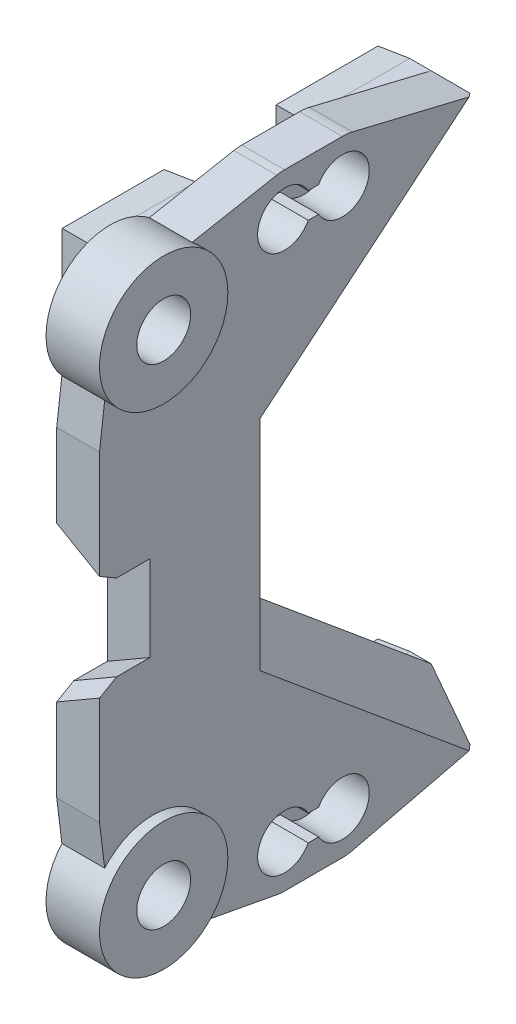
from build123d import *
from OCP.BRepFilletAPI import BRepFilletAPI_MakeChamfer

# Parameters (mm, degrees)
DOWELSUPPORT_DEPTH       = 1.905
DOWELSUPPORT_DEPTH_BACK  = 1.27
SKETCH3_R                = 3.81
SKETCH5_W                = 9.525
SKETCH5_H                = 19.05
SLIDERDOWELSUPPORT_DEPTH = 1.27
STRINGDOWELSUPPORT_DEPTH = 1.27
SKETCH9_W                = 6.35
SKETCH9_H                = 3
TABSUPPORT_DEPTH         = 1.27
INTERSUPPORT_DEPTH       = 1.27
DOWELHOLES_DEPTH         = 25.48367648
DOWELHOLES_DEPTH_BACK    = 25.48367648
SKETCH11_R               = 1.600000102
BOSS_EXTRUDE1_START      = -1.27
SKETCH11_2_R             = 1.600000102
BOSS_EXTRUDE1_DEPTH      = 0.254
SKETCH14_W               = 6.35
SKETCH14_H               = 3
TABBASE_DEPTH            = 1.27
SKETCH15_W               = 6.35
SKETCH15_H               = 3
TABDRAFT_DEPTH           = 1.73
TABDRAFT_DRAFT           = 5
TABDRAFT_PROFILE_2_DEPTH = 1.73
TABDRAFT_PROFILE_2_DRAFT = 5
CHAMFER1_SIZE            = 2.54
CUT_EXTRUDE2_DEPTH       = 3
CHAMFER2_SIZE            = 0.508
CHAMFER2_SIZE2           = 1.016


with BuildPart() as part:
    # Sketch3 → DowelSupport (new, two sides: drawn at the far end of the back side and taken through both)
    with BuildSketch(Plane(origin=(0, 0, 0), x_dir=(0, 0, -1), z_dir=(1, 0, 0)).offset(-DOWELSUPPORT_DEPTH_BACK)):
        with Locations((-3.175, 14.53375)):
            Circle(SKETCH3_R)
    extrude(amount=DOWELSUPPORT_DEPTH + DOWELSUPPORT_DEPTH_BACK)



with BuildPart() as body_2:
    # Sketch5 → SliderDowelSupport (new, symmetric)
    with BuildSketch(Plane(origin=(0, 0, 0), x_dir=(0, 0, -1), z_dir=(1, 0, 0))):
        with Locations((-1.5875, 0)):
            Rectangle(SKETCH5_W, SKETCH5_H)
    extrude(amount=SLIDERDOWELSUPPORT_DEPTH, both=True)


with BuildPart() as body_3:
    # Sketch8 → StringDowelSupport (new, symmetric)
    with BuildSketch(Plane(origin=(0, 0, 0), x_dir=(0, 0, -1), z_dir=(1, 0, 0))):
        with BuildLine():
            Line((4.6355, 18.542), (8.0645, 18.542))
            ThreePointArc((8.0645, 18.542), (10.6045, 16.002), (8.0645, 13.462))
            Line((8.0645, 13.462), (4.6355, 13.462))
            ThreePointArc((4.6355, 13.462), (2.0955, 16.002), (4.6355, 18.542))
        make_face()
    extrude(amount=STRINGDOWELSUPPORT_DEPTH, both=True)


with BuildPart() as part_1:
    add(part.part)

    add(body_3.part)  # TabSupport merges body 3
    # Sketch9 → TabSupport (add, symmetric)
    with BuildSketch(Plane(origin=(0, 0, 0), x_dir=(0, 0, -1), z_dir=(1, 0, 0))):
        with Locations((0, 15.24)):
            Rectangle(SKETCH9_W, SKETCH9_H)
        with Locations((12.7, 15.24)):
            Rectangle(SKETCH9_W, SKETCH9_H)
    extrude(amount=TABSUPPORT_DEPTH, both=True)


    add(body_2.part)  # InterSupport merges body 2
    # Sketch10 → InterSupport (add, symmetric)
    with BuildSketch(Plane(origin=(0, 0, 0), x_dir=(0, 0, -1), z_dir=(1, 0, 0))):
        Polygon((-6.35, 9.525), (-5.696013987, 14.843731414), (-3.644260291, 17.030026182), (4.166239709, 18.498276182), (8.657140431, 18.471894192), (15.875, 16.74), (15.875, 13.74), (3.175, 3.175), (3.175, 9.525), align=None)
    extrude(amount=INTERSUPPORT_DEPTH, both=True)

    # Sketch11 → DowelHoles (cut, two sides: drawn at the far end of the back side and taken through both)
    with BuildSketch(Plane(origin=(0, 0, 0), x_dir=(0, 0, -1), z_dir=(1, 0, 0)).offset(-DOWELHOLES_DEPTH_BACK)):
        with Locations((-3.175, 14.53375)):
            Circle(SKETCH11_R)
        with BuildLine():
            Line((6.04239599, 15.24), (6.65760401, 15.24))
            ThreePointArc((6.65760401, 15.24), (9.664500102, 16.002), (6.65760401, 16.764))
            Line((6.65760401, 16.764), (6.04239599, 16.764))
            ThreePointArc((6.04239599, 16.764), (3.035499898, 16.002), (6.04239599, 15.24))
        make_face()
    extrude(amount=DOWELHOLES_DEPTH + DOWELHOLES_DEPTH_BACK, mode=Mode.SUBTRACT)

    # Sketch11<2> → Boss-Extrude1 (add)
    with BuildSketch(Plane(origin=(0, 0, 0), x_dir=(0, 0, -1), z_dir=(1, 0, 0)).offset(BOSS_EXTRUDE1_START)):
        with BuildLine():
            Line((6.04239599, 15.24), (6.65760401, 15.24))
            ThreePointArc((6.65760401, 15.24), (9.664500102, 16.002), (6.65760401, 16.764))
            Line((6.65760401, 16.764), (6.04239599, 16.764))
            ThreePointArc((6.04239599, 16.764), (3.035499898, 16.002), (6.04239599, 15.24))
        make_face()
        with Locations((-3.175, 14.53375)):
            Circle(SKETCH11_2_R)
    extrude(amount=BOSS_EXTRUDE1_DEPTH)

    # Sketch14 → TabBase (add)
    with BuildSketch(Plane.ZY.offset(1.27)):
        with Locations((-12.7, 15.24)):
            Rectangle(SKETCH14_W, SKETCH14_H)
        with Locations((0, 15.24)):
            Rectangle(SKETCH14_W, SKETCH14_H)
    extrude(amount=TABBASE_DEPTH)


with BuildPart() as tabdraft_tool:
    # Sketch15 → TabDraft (with draft: the straight prism first)
    with BuildSketch(Plane.ZY.offset(2.54)):
        with Locations((0, 15.24)):
            Rectangle(SKETCH15_W, SKETCH15_H)
    extrude(amount=TABDRAFT_DEPTH)
    # TabDraft: the draft: its side faces are tilted about the plane it starts from
    tabdraft_sides = [tabdraft_tool.faces().sort_by_distance(p)[0] for p in [
        (-3.405, 15.24, -3.175),
        (-3.405, 13.74, 0),
        (-3.405, 15.24, 3.175),
        (-3.405, 16.74, 0),
    ]]
    draft(tabdraft_sides, Plane.ZY.offset(2.54), TABDRAFT_DRAFT)


with BuildPart() as part_2:
    add(part_1.part)

    # TabDraft: add tabdraft_tool
    add(tabdraft_tool.part)


with BuildPart() as tabdraft_profile_2_tool:
    # Sketch15 → TabDraft profile 2 (with draft: the straight prism first)
    with BuildSketch(Plane.ZY.offset(2.54)):
        with Locations((-12.7, 15.24)):
            Rectangle(SKETCH15_W, SKETCH15_H)
    extrude(amount=TABDRAFT_PROFILE_2_DEPTH)
    # TabDraft profile 2: the draft: its side faces are tilted about the plane it starts from
    tabdraft_profile_2_sides = [tabdraft_profile_2_tool.faces().sort_by_distance(p)[0] for p in [
        (-3.405, 15.24, -15.875),
        (-3.405, 13.74, -12.7),
        (-3.405, 15.24, -9.525),
        (-3.405, 16.74, -12.7),
    ]]
    draft(tabdraft_profile_2_sides, Plane.ZY.offset(2.54), TABDRAFT_PROFILE_2_DRAFT)


with BuildPart() as part_3:
    add(part_2.part)

    # TabDraft profile 2: add tabdraft_profile_2_tool
    add(tabdraft_profile_2_tool.part)

    # Chamfer1
    chamfer1_edges = [part_3.edges().sort_by_distance(p)[0] for p in [
        (1.27, 8.4575, -9.525),
    ]]
    chamfer(chamfer1_edges, length=CHAMFER1_SIZE - 0.0001)  # a hair under: the kernel refuses the full size

    # Mirror1: part across plane


with BuildPart() as part_4:
    add(part_3.part)
    add(part_3.part.mirror(Plane.ZX))

    # Sketch17 → Cut-Extrude2 (cut)
    with BuildSketch(Plane.XY.offset(6.35)):
        Polygon((-1.27, -4.006469684), (1.27, -2.54), (1.27, 2.54), (-1.27, 4.006469684), align=None)
    extrude(amount=-CUT_EXTRUDE2_DEPTH, mode=Mode.SUBTRACT)

    # Chamfer2: one chamfer whose edges measure the first distance from different faces: ONE call of the kernel's chamfer builder (chamfer() names one face for all edges)
    chamfer2_edges_1 = [part_4.edges().sort_by_distance(p)[0] for p in [
        (0, -3.273234842, 6.35),
    ]]
    chamfer2_side_1 = [part_4.faces().sort_by_distance(p)[0] for p in [
        (0.049650417, -6.38478458, 6.35),
    ]]
    chamfer2_edges_2 = [part_4.edges().sort_by_distance(p)[0] for p in [
        (0, 3.273234842, 6.35),
    ]]
    chamfer2_side_2 = [part_4.faces().sort_by_distance(p)[0] for p in [
        (0.049650417, 6.38478458, 6.35),
    ]]
    chamfer2 = BRepFilletAPI_MakeChamfer(part_4.part.solid().wrapped)
    for e in chamfer2_edges_1:
        chamfer2.Add(CHAMFER2_SIZE, CHAMFER2_SIZE2, e.wrapped, chamfer2_side_1[0].wrapped)  # the first distance lies on this face
    for e in chamfer2_edges_2:
        chamfer2.Add(CHAMFER2_SIZE, CHAMFER2_SIZE2, e.wrapped, chamfer2_side_2[0].wrapped)  # the first distance lies on this face
    add(Compound.cast(chamfer2.Shape()), mode=Mode.REPLACE)


solid = part_4.part
